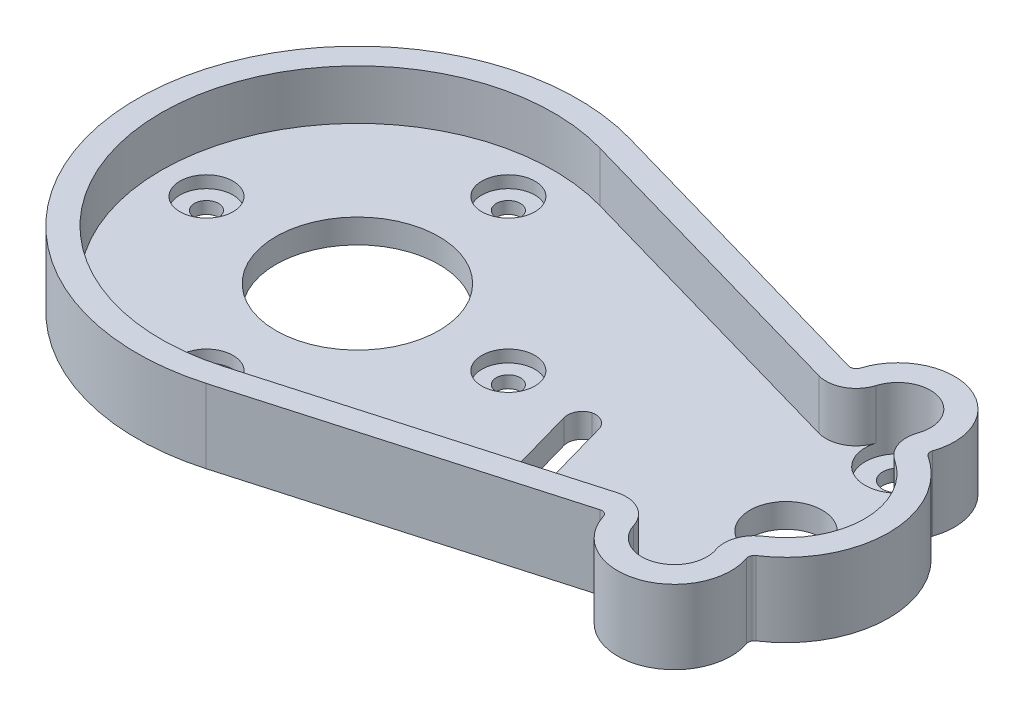
from build123d import *

# Parameters (mm, degrees)
SKETCH1_W               = 175
SKETCH1_H               = 100
SKETCH1_R               = 6
SKETCH1_R_2             = 13.5
SKETCH1_R_3             = 2
SKETCH1_R_4             = 2.5
BOSS_EXTRUDE1_DEPTH     = 4
SKETCH3_W               = 175
SKETCH3_H               = 100
BOSS_EXTRUDE2_DEPTH     = 8.25
SKETCH6_R               = 5.4
CUT_EXTRUDE2_DEPTH      = 8.25
FILLET1_R               = 2.5
FILLET2_R               = 5
SKETCH2_R               = 4.4
SKETCH2_R_2             = 5.4
CUT_EXTRUDE1_DEPTH      = 2
CUT_EXTRUDE4_DEPTH      = 102.520010478
CUT_EXTRUDE4_DEPTH_BACK = 102.520010478
SKETCH7_OUTSIDE_W       = 217.386
SKETCH7_OUTSIDE_H       = 142.386


with BuildPart() as part:
    # Sketch1 → Boss-Extrude1 (new body)
    with BuildSketch(Plane(origin=(0, 0, 0), x_dir=(1, 0, 0), z_dir=(0, 1, 0))):
        Rectangle(SKETCH1_W, SKETCH1_H)
        with Locations(Location((35.5, 0, 0), (0, 0, 270))):
            Circle(SKETCH1_R, mode=Mode.SUBTRACT)
        with Locations(Location((-35.5, 0, 0), (0, 0, 270))):
            Circle(SKETCH1_R_2, mode=Mode.SUBTRACT)
        with Locations(Location((-60.5, 0, 0), (0, 0, 270))):
            Circle(SKETCH1_R_3, mode=Mode.SUBTRACT)
        with Locations(Location((-35.5, 25, 0), (0, 0, 270))):
            Circle(SKETCH1_R_3, mode=Mode.SUBTRACT)
        with Locations(Location((-10.5, 0, 0), (0, 0, 270))):
            Circle(SKETCH1_R_3, mode=Mode.SUBTRACT)
        with Locations(Location((-35.5, -25, 0), (0, 0, 270))):
            Circle(SKETCH1_R_3, mode=Mode.SUBTRACT)
        with Locations(Location((35.5, 18.5, 0), (0, 0, 270))):
            Circle(SKETCH1_R_4, mode=Mode.SUBTRACT)
        with Locations(Location((35.5, -18.5, 0), (0, 0, 90))):
            Circle(SKETCH1_R_4, mode=Mode.SUBTRACT)
        Polygon((4.517711304, -15.136418767), (0.159242352, 0.258507293), (4.681501882, 1.538807548), (9.039970835, -13.856118512), (9.584779454, -15.78048427), (5.062519924, -17.060784524), align=None, mode=Mode.SUBTRACT)
    extrude(amount=BOSS_EXTRUDE1_DEPTH)

    # Sketch3 → Boss-Extrude2 (add)
    with BuildSketch(Plane(origin=(0, 4, 0), x_dir=(1, 0, 0), z_dir=(0, 1, 0))):
        Rectangle(SKETCH3_W, SKETCH3_H)
        with BuildLine():
            Line((-26.573943662, 31.250208291), (39.070422535, 12.500083317))
            ThreePointArc((39.070422535, 12.500083317), (48.5, 0), (39.070422535, -12.500083317))
            Line((39.070422535, -12.500083317), (-26.573943662, -31.250208291))
            ThreePointArc((-26.573943662, -31.250208291), (-68, 0), (-26.573943662, 31.250208291))
        make_face(mode=Mode.SUBTRACT)
    extrude(amount=BOSS_EXTRUDE2_DEPTH)

    # Sketch6 → Cut-Extrude2 (cut)
    with BuildSketch(Plane(origin=(0, 12.25, 0), x_dir=(1, 0, 0), z_dir=(0, 1, 0))):
        with Locations((35.5, 18.5)):
            Circle(SKETCH6_R)
        with Locations((35.5, -18.5)):
            Circle(SKETCH6_R)
    extrude(amount=-CUT_EXTRUDE2_DEPTH, mode=Mode.SUBTRACT)

    # Fillet1
    # the kernel refuses this fillet: 2.5 mm, written as the material it adds along each edge
    with BuildSketch(Plane(origin=(9.584779454, 0, 15.78048427), x_dir=(-0.9621828787440704, 0, 0.2724043095323078), z_dir=(0, 1, 0)), Plane(origin=(5.062519924, 0, 17.060784524), x_dir=(-0.2724043095323173, 0, -0.9621828787440677), z_dir=(0, 1, 0)), Plane(origin=(4.681501882, 0, -1.538807548), x_dir=(0.2724043095323092, 0, 0.96218287874407), z_dir=(0, 1, 0))) as fillet1_piece_1:
        with BuildLine():
            CenterArc((FILLET1_R, -FILLET1_R), FILLET1_R, 90, 90)
            Line((0, -FILLET1_R), (0, 0))
            Line((0, 0), (FILLET1_R, 0))
        make_face()
    extrude(amount=4)
    with BuildSketch(Plane(origin=(0.159242352, 0, -0.258507293), x_dir=(0.2724043095323079, 0, 0.9621828787440704), z_dir=(0, 1, 0))) as fillet1_piece_2:
        with BuildLine():
            CenterArc((FILLET1_R, FILLET1_R), FILLET1_R, 180, 90)
            Line((0, FILLET1_R), (0, 0))
            Line((0, 0), (FILLET1_R, 0))
        make_face()
    extrude(amount=4)

    # Fillet2
    fillet2_edges = [part.edges().sort_by_distance(p)[0] for p in [
        (31.784909874, 8.125, 14.581058133),
        (36.584743308, 8.125, 13.210072594),
        (36.584743308, 8.125, -13.210072594),
        (31.784909874, 8.125, -14.581058133),
    ]]
    fillet(fillet2_edges, radius=FILLET2_R)

    # Sketch2 → Cut-Extrude1 (cut)
    with BuildSketch(Plane(origin=(0, 4, 0), x_dir=(1, 0, 0), z_dir=(0, 1, 0))):
        with Locations(Location((-35.5, 25, 0), (0, 0, 270))):
            Circle(SKETCH2_R)
        with Locations(Location((-10.5, 0, 0), (0, 0, 270))):
            Circle(SKETCH2_R)
        with Locations(Location((-35.5, -25, 0), (0, 0, 270))):
            Circle(SKETCH2_R)
        with Locations(Location((-60.5, 0, 0), (0, 0, 270))):
            Circle(SKETCH2_R)
        with Locations(Location((35.5, 18.5, 0), (0, 0, 270))):
            Circle(SKETCH2_R_2)
        with Locations(Location((35.5, -18.5, 0), (0, 0, 197.105868404))):
            Circle(SKETCH2_R_2)
    extrude(amount=-CUT_EXTRUDE1_DEPTH, mode=Mode.SUBTRACT)

    # Sketch7 outside → Cut-Extrude4 (cut, two sides: drawn at the far end of the back side and taken through both)
    with BuildSketch(Plane(origin=(0, 12.25, 0), x_dir=(1, 0, 0), z_dir=(0, 1, 0)).offset(-CUT_EXTRUDE4_DEPTH_BACK)):
        Rectangle(SKETCH7_OUTSIDE_W, SKETCH7_OUTSIDE_H)
        with BuildLine():
            Line((-25.475352113, -35.096387773), (25.285418022, -20.597492606))
            ThreePointArc((25.285418022, -20.597492606), (26.036864948, -20.680025145), (26.515828803, -21.264899257))
            ThreePointArc((26.515828803, -21.264899257), (38.426917352, -27.432701429), (44.378310133, -15.41202183))
            ThreePointArc((44.378310133, -15.41202183), (44.376580158, -14.760021946), (44.777099477, -14.245540541))
            ThreePointArc((44.777099477, -14.245540541), (52.5, 0), (44.777099477, 14.245540541))
            ThreePointArc((44.777099477, 14.245540541), (44.376580158, 14.760021946), (44.378310133, 15.41202183))
            ThreePointArc((44.378310133, 15.41202183), (38.426917352, 27.432701429), (26.515828803, 21.264899257))
            ThreePointArc((26.515828803, 21.264899257), (26.036864948, 20.680025145), (25.285418022, 20.597492606))
            Line((25.285418022, 20.597492606), (-25.475352113, 35.096387773))
            ThreePointArc((-25.475352113, 35.096387773), (-72, 0), (-25.475352113, -35.096387773))
        make_face(mode=Mode.SUBTRACT)
    extrude(amount=CUT_EXTRUDE4_DEPTH + CUT_EXTRUDE4_DEPTH_BACK, mode=Mode.SUBTRACT)


solid = part.part
